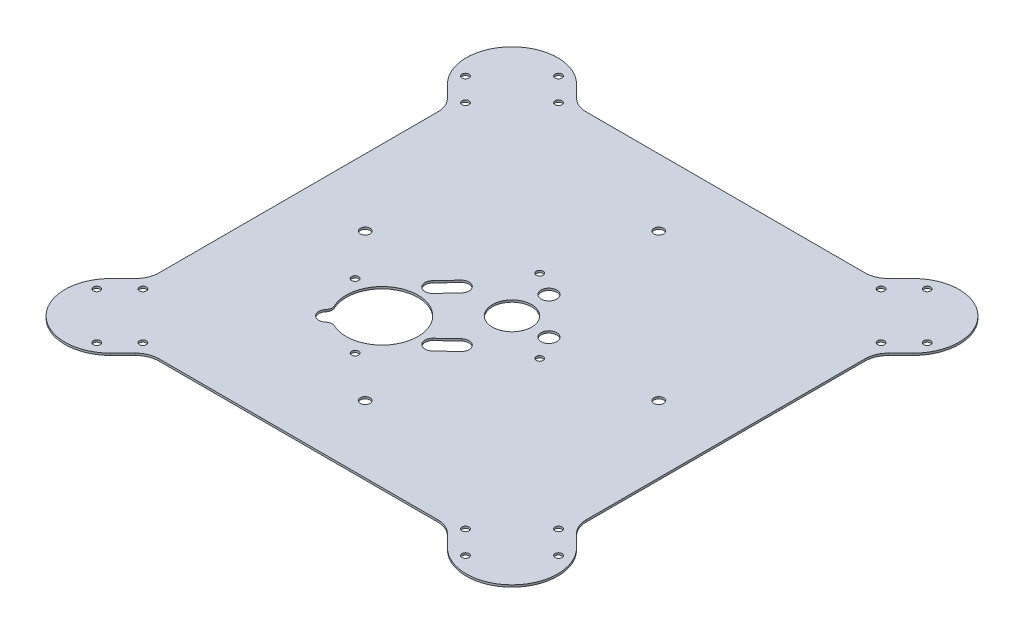
from build123d import *

# Parameters (mm, degrees)
SKETCH1_R                    = 212.725
BOSS_EXTRUDE1_DEPTH          = 1.9939
SKETCH2_R                    = 19.05
SKETCH2_R_2                  = 7.62
SKETCH2_R_3                  = 34.925
CUT_EXTRUDE1_DEPTH           = 301.845187575
BOSS_EXTRUDE2_START          = -1.9939
BOSS_EXTRUDE2_DEPTH          = 1.9939
FILLET1_R                    = 25.4
F_1_4_CLEARANCE_HOLE2_D      = 6.7564
FILLET2_R                    = 6.35
BOSS_EXTRUDE3_START          = -1.9939
BOSS_EXTRUDE3_DEPTH          = 1.9939
F_3_8_0_405_DIAMETER_HOLE1_D = 9.525
CUT_EXTRUDE2_DEPTH           = 340.09265521
FILLET3_R                    = 22.86


with BuildPart() as part:
    # Sketch1 → Boss-Extrude1 (new body)
    with BuildSketch(Plane(origin=(0, 0, 0), x_dir=(1, 0, 0), z_dir=(0, 1, 0))):
        with Locations(Location((0, 0, 0), (0, 0, 270))):
            Circle(SKETCH1_R)
    extrude(amount=BOSS_EXTRUDE1_DEPTH)

    # Sketch2 → Cut-Extrude1 (cut, through all)
    with BuildSketch(Plane(origin=(0, 1.9939, 0), x_dir=(1, 0, 0), z_dir=(0, 1, 0))):
        with Locations(Location((0, 0, 0), (0, 0, 270))):
            Circle(SKETCH2_R)
        with Locations(Location((35.921024484, 0, 0), (0, 0, 270))):
            Circle(SKETCH2_R_2)
        with Locations(Location((0, 35.921024484, 0), (0, 0, 270))):
            Circle(SKETCH2_R_2)
        with BuildLine():
            ThreePointArc((-54.951572567, 5.210468059), (-44.180940607, 5.560163901), (-43.831244764, -5.210468059))
            Line((-43.831244764, -5.210468059), (-57.211826385, -19.489075291))
            ThreePointArc((-57.211826385, -19.489075291), (-67.982458345, -19.838771134), (-68.332154188, -9.068139174))
            Line((-68.332154188, -9.068139174), (-54.951572567, 5.210468059))
        make_face()
        with BuildLine():
            ThreePointArc((-9.068139174, -68.332154188), (-19.838771134, -67.982458345), (-19.489075291, -57.211826385))
            Line((-19.489075291, -57.211826385), (-5.210468059, -43.831244764))
            ThreePointArc((-5.210468059, -43.831244764), (5.560163901, -44.180940607), (5.210468059, -54.951572567))
            Line((5.210468059, -54.951572567), (-9.068139174, -68.332154188))
        make_face()
        with Locations((-63.221003092, -63.221003092)):
            Circle(SKETCH2_R_3)
        with BuildLine():
            ThreePointArc((-82.803000118, -92.139872667), (-87.916707425, -87.916707425), (-92.139872667, -82.803000118))
            ThreePointArc((-92.139872667, -82.803000118), (-95.549925128, -95.549925128), (-82.803000118, -92.139872667))
        make_face()
    extrude(amount=-CUT_EXTRUDE1_DEPTH, mode=Mode.SUBTRACT)

    # Sketch3 → Boss-Extrude2 (add)
    with BuildSketch(Plane(origin=(0, 1.9939, 0), x_dir=(1, 0, 0), z_dir=(0, 1, 0)).offset(BOSS_EXTRUDE2_START)):
        with BuildLine():
            Line((178.529712063, -115.667919216), (226.751467057, -163.88967421))
            ThreePointArc((226.751467057, -163.88967421), (226.751467057, -226.751467057), (163.88967421, -226.751467057))
            Line((163.88967421, -226.751467057), (115.667919216, -178.529712063))
            ThreePointArc((115.667919216, -178.529712063), (150.419290028, -150.419290028), (178.529712063, -115.667919216))
        make_face()
        with BuildLine():
            Line((-178.529712063, -115.667919216), (-226.751467057, -163.88967421))
            ThreePointArc((-226.751467057, -163.88967421), (-226.751467057, -226.751467057), (-163.88967421, -226.751467057))
            Line((-163.88967421, -226.751467057), (-115.667919216, -178.529712063))
            ThreePointArc((-115.667919216, -178.529712063), (-150.419290028, -150.419290028), (-178.529712063, -115.667919216))
        make_face()
        with BuildLine():
            Line((-115.667919216, 178.529712063), (-163.88967421, 226.751467057))
            ThreePointArc((-163.88967421, 226.751467057), (-226.751467057, 226.751467057), (-226.751467057, 163.88967421))
            Line((-226.751467057, 163.88967421), (-178.529712063, 115.667919216))
            ThreePointArc((-178.529712063, 115.667919216), (-150.419290028, 150.419290028), (-115.667919216, 178.529712063))
        make_face()
        with BuildLine():
            Line((178.529712063, 115.667919216), (226.751467057, 163.88967421))
            ThreePointArc((226.751467057, 163.88967421), (226.751467057, 226.751467057), (163.88967421, 226.751467057))
            Line((163.88967421, 226.751467057), (115.667919216, 178.529712063))
            ThreePointArc((115.667919216, 178.529712063), (150.419290028, 150.419290028), (178.529712063, 115.667919216))
        make_face()
    extrude(amount=BOSS_EXTRUDE2_DEPTH)

    # Fillet1
    fillet1_edges = [part.edges().sort_by_distance(p)[0] for p in [
        (115.667919216, 0.99695, 178.529712063),
        (178.529712063, 0.99695, 115.667919216),
        (-178.529712063, 0.99695, 115.667919216),
        (-115.667919216, 0.99695, 178.529712063),
        (-115.667919216, 0.99695, -178.529712063),
        (-178.529712063, 0.99695, -115.667919216),
        (178.529712063, 0.99695, -115.667919216),
        (115.667919216, 0.99695, -178.529712063),
    ]]
    fillet(fillet1_edges, radius=FILLET1_R)

    # 1/4 Clearance Hole2 (through all)
    with Locations(Plane(origin=(0, 1.9939, 0), x_dir=(1, 0, 0), z_dir=(0, 1, 0))):
        with Locations((-202.235367846, 156.974876996), (-224.686008149, 179.425517299), (-156.974876996, 202.235367846), (-179.425517299, 224.686008149), (202.235367846, -156.974876996), (224.686008149, -179.425517299), (156.974876996, -202.235367846), (179.425517299, -224.686008149), (224.686008149, 179.425517299), (202.235367846, 156.974876996), (179.425517299, 224.686008149), (156.974876996, 202.235367846), (-202.235367846, -156.974876996), (-224.686008149, -179.425517299), (-156.974876996, -202.235367846), (-179.425517299, -224.686008149), (49.391408666, -22.450640303), (-44.901280605, -107.763073453), (-107.763073453, -44.901280605), (-22.450640303, 49.391408666)):
            Hole(F_1_4_CLEARANCE_HOLE2_D / 2)

    # Fillet2
    fillet2_edges = [part.edges().sort_by_distance(p)[0] for p in [
        (-92.139872667, 0.99695, 82.803000118),
        (-82.803000118, 0.99695, 92.139872667),
    ]]
    fillet(fillet2_edges, radius=FILLET2_R)

    # Sketch12 → Boss-Extrude3 (add)
    with BuildSketch(Plane(origin=(0, 1.9939, 0), x_dir=(1, 0, 0), z_dir=(0, 1, 0)).offset(BOSS_EXTRUDE3_START)):
        with BuildLine():
            Line((-129.541916692, -192.40370954), (-149.863207153, -212.725))
            Line((-149.863207153, -212.725), (0, -212.725))
            ThreePointArc((0, -212.725), (-51.359035142, -206.432010924), (-99.679387975, -187.925371459))
            ThreePointArc((-99.679387975, -187.925371459), (-115.348395389, -185.245109949), (-129.541916692, -192.40370954))
        make_face()
        with BuildLine():
            ThreePointArc((99.679387975, -187.925371459), (51.359035142, -206.432010924), (0, -212.725))
            Line((0, -212.725), (149.863207153, -212.725))
            Line((149.863207153, -212.725), (129.541916692, -192.40370954))
            ThreePointArc((129.541916692, -192.40370954), (115.348395389, -185.245109949), (99.679387975, -187.925371459))
        make_face()
        with BuildLine():
            ThreePointArc((-187.925371459, -99.679387975), (-206.432010924, -51.359035142), (-212.725, 0))
            Line((-212.725, 0), (-212.725, -149.863207153))
            Line((-212.725, -149.863207153), (-192.40370954, -129.541916692))
            ThreePointArc((-192.40370954, -129.541916692), (-185.245109949, -115.348395389), (-187.925371459, -99.679387975))
        make_face()
        with BuildLine():
            Line((-192.40370954, 129.541916692), (-212.725, 149.863207153))
            Line((-212.725, 149.863207153), (-212.725, 0))
            ThreePointArc((-212.725, 0), (-206.432010924, 51.359035142), (-187.925371459, 99.679387976))
            ThreePointArc((-187.925371459, 99.679387976), (-185.245109949, 115.348395389), (-192.40370954, 129.541916692))
        make_face()
        with BuildLine():
            ThreePointArc((-99.679387975, 187.925371459), (-51.359035455, 206.432010847), (-6.44e-07, 212.725))
            Line((-6.44e-07, 212.725), (-149.863207153, 212.725))
            Line((-149.863207153, 212.725), (-129.541916692, 192.40370954))
            ThreePointArc((-129.541916692, 192.40370954), (-115.348395389, 185.245109949), (-99.679387975, 187.925371459))
        make_face()
        with BuildLine():
            Line((129.541916692, 192.40370954), (149.863207153, 212.725))
            Line((149.863207153, 212.725), (-6.44e-07, 212.725))
            ThreePointArc((-6.44e-07, 212.725), (51.35903483, 206.432011002), (99.679387976, 187.925371459))
            ThreePointArc((99.679387976, 187.925371459), (115.348395389, 185.245109949), (129.541916692, 192.40370954))
        make_face()
        with BuildLine():
            ThreePointArc((187.925371459, 99.679387975), (206.432011089, 51.35903448), (212.725, -1.365e-06))
            Line((212.725, -1.365e-06), (212.725, 149.863207153))
            Line((212.725, 149.863207153), (192.40370954, 129.541916692))
            ThreePointArc((192.40370954, 129.541916692), (185.245109949, 115.348395389), (187.925371459, 99.679387975))
        make_face()
        with BuildLine():
            Line((192.40370954, -129.541916692), (212.725, -149.863207153))
            Line((212.725, -149.863207153), (212.725, -1.365e-06))
            ThreePointArc((212.725, -1.365e-06), (206.43201076, -51.359035805), (187.925371459, -99.679387976))
            ThreePointArc((187.925371459, -99.679387976), (185.245109949, -115.348395389), (192.40370954, -129.541916692))
        make_face()
    extrude(amount=BOSS_EXTRUDE3_DEPTH)

    # 3/8 (0.405) Diameter Hole1 (through all)
    with Locations(Plane(origin=(0, 1.9939, 0), x_dir=(1, 0, 0), z_dir=(0, 1, 0))):
        with Locations((0, -142.875), (-142.875, 0), (142.875, 0), (0, 142.875)):
            Hole(F_3_8_0_405_DIAMETER_HOLE1_D / 2)

    # Sketch32 → Cut-Extrude2 (cut, through all)
    with BuildSketch(Plane(origin=(0, 1.9939, 0), x_dir=(1, 0, 0), z_dir=(0, 1, 0))):
        Polygon((-149.863207153, -212.725), (-145.100707153, -207.9625), (145.100707153, -207.9625), (149.863207153, -212.725), align=None)
        Polygon((-212.725, 149.863207153), (-207.9625, 145.100707153), (-207.9625, -145.100707153), (-212.725, -149.863207153), align=None)
        Polygon((149.863207153, 212.725), (145.100707153, 207.9625), (-145.100707153, 207.9625), (-149.863207153, 212.725), align=None)
        Polygon((212.725, -149.863207153), (207.9625, -145.100707153), (207.9625, 145.100707153), (212.725, 149.863207153), align=None)
    extrude(amount=-CUT_EXTRUDE2_DEPTH, mode=Mode.SUBTRACT)

    # Fillet3
    fillet3_edges = [part.edges().sort_by_distance(p)[0] for p in [
        (-145.100707153, 0.99695, 207.9625),
        (145.100707153, 0.99695, 207.9625),
        (-207.9625, 0.99695, -145.100707153),
        (-207.9625, 0.99695, 145.100707153),
        (145.100707153, 0.99695, -207.9625),
        (-145.100707153, 0.99695, -207.9625),
        (207.9625, 0.99695, 145.100707153),
        (207.9625, 0.99695, -145.100707153),
    ]]
    fillet(fillet3_edges, radius=FILLET3_R)


solid = part.part
